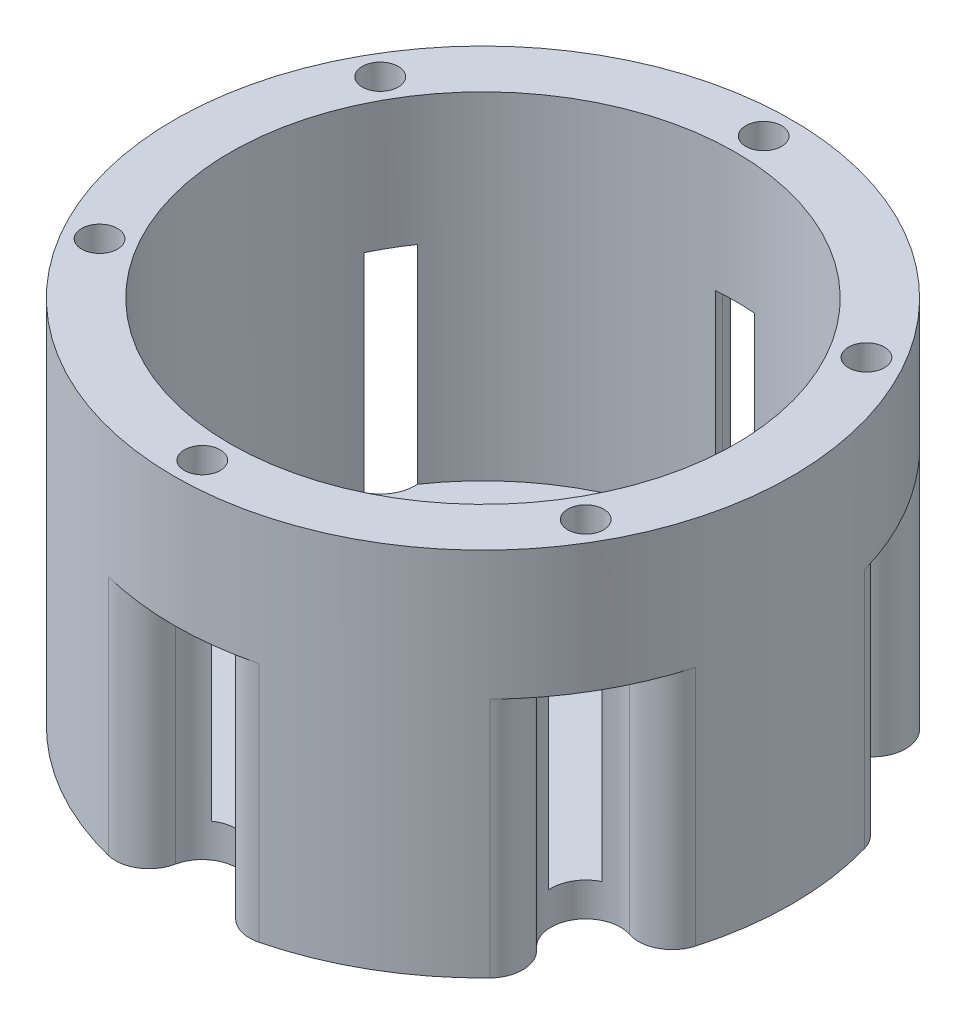
from build123d import *

# Parameters (mm, degrees)
SKETCH1_R                = 27.5
SKETCH1_R_2              = 1.6
BOSS_EXTRUDE1_DEPTH      = 33
SKETCH2_R                = 22.5
CUT_EXTRUDE1_DEPTH       = 30
SKETCH3_R                = 3.1
CUT_EXTRUDE2_DEPTH       = 21.5
FILLET1_R                = 3
CIRPATTERN1_COUNT        = 6
FILLET1_OF_CIRPATTERN1_R = 3
SKETCH5_R                = 1.6
CUT_EXTRUDE3_DEPTH       = 10


with BuildPart() as part:
    # Sketch1 → Boss-Extrude1 (new body)
    with BuildSketch(Plane(origin=(0, 0, 0), x_dir=(1, 0, 0), z_dir=(0, 1, 0))):
        Circle(SKETCH1_R)
        with Locations((0, 25)):
            Circle(SKETCH1_R_2, mode=Mode.SUBTRACT)
        with Locations((21.650635095, 12.5)):
            Circle(SKETCH1_R_2, mode=Mode.SUBTRACT)
        with Locations((21.650635095, -12.5)):
            Circle(SKETCH1_R_2, mode=Mode.SUBTRACT)
        with Locations((0, -25)):
            Circle(SKETCH1_R_2, mode=Mode.SUBTRACT)
        with Locations((-21.650635095, -12.5)):
            Circle(SKETCH1_R_2, mode=Mode.SUBTRACT)
        with Locations((-21.650635095, 12.5)):
            Circle(SKETCH1_R_2, mode=Mode.SUBTRACT)
    extrude(amount=BOSS_EXTRUDE1_DEPTH)

    # Sketch2 → Cut-Extrude1 (cut)
    with BuildSketch(Plane(origin=(0, 33, 0), x_dir=(1, 0, 0), z_dir=(0, 1, 0))):
        Circle(SKETCH2_R)
    extrude(amount=-CUT_EXTRUDE1_DEPTH, mode=Mode.SUBTRACT)

    # Sketch3 → Cut-Extrude2 (cut)
    with BuildSketch(Plane.XZ):
        with Locations((0, 25)):
            Circle(SKETCH3_R)
    cut_extrude2 = extrude(amount=-CUT_EXTRUDE2_DEPTH, mode=Mode.SUBTRACT)

    # Fillet1
    fillet1_edges = [part.edges().sort_by_distance(p)[0] for p in [
        (-1.921323544, 10.75, 27.4328),
        (1.921323544, 10.75, 27.4328),
    ]]
    fillet(fillet1_edges, radius=FILLET1_R)

    # CirPattern1: Cut-Extrude2 ×6 about axis
    cirpattern1_axis = Axis((0, 33, 0), (0, -1, 0))
    for i in range(1, CIRPATTERN1_COUNT):
        add(cut_extrude2.rotate(cirpattern1_axis, i * 360 / CIRPATTERN1_COUNT), mode=Mode.SUBTRACT)

    # Fillet1 of CirPattern1
    fillet1_of_cirpattern1_edges = [part.edges().sort_by_distance(p)[0] for p in [
        (-24.718163469, 10.75, 12.052485002),
        (-22.796839925, 10.75, 15.380314998),
        (-22.796839925, 10.75, -15.380314998),
        (-24.718163469, 10.75, -12.052485002),
        (1.921323544, 10.75, -27.4328),
        (-1.921323544, 10.75, -27.4328),
        (24.718163469, 10.75, -12.052485002),
        (22.796839925, 10.75, -15.380314998),
        (22.796839925, 10.75, 15.380314998),
        (24.718163469, 10.75, 12.052485002),
    ]]
    fillet(fillet1_of_cirpattern1_edges, radius=FILLET1_OF_CIRPATTERN1_R)

    # Sketch5 → Cut-Extrude3 (cut)
    with BuildSketch(Plane.XZ):
        with Locations((-8, 8)):
            Circle(SKETCH5_R)
        with Locations((8, 8)):
            Circle(SKETCH5_R)
        with Locations((8, -8)):
            Circle(SKETCH5_R)
        with Locations((-8, -8)):
            Circle(SKETCH5_R)
    extrude(amount=-CUT_EXTRUDE3_DEPTH, mode=Mode.SUBTRACT)


solid = part.part
